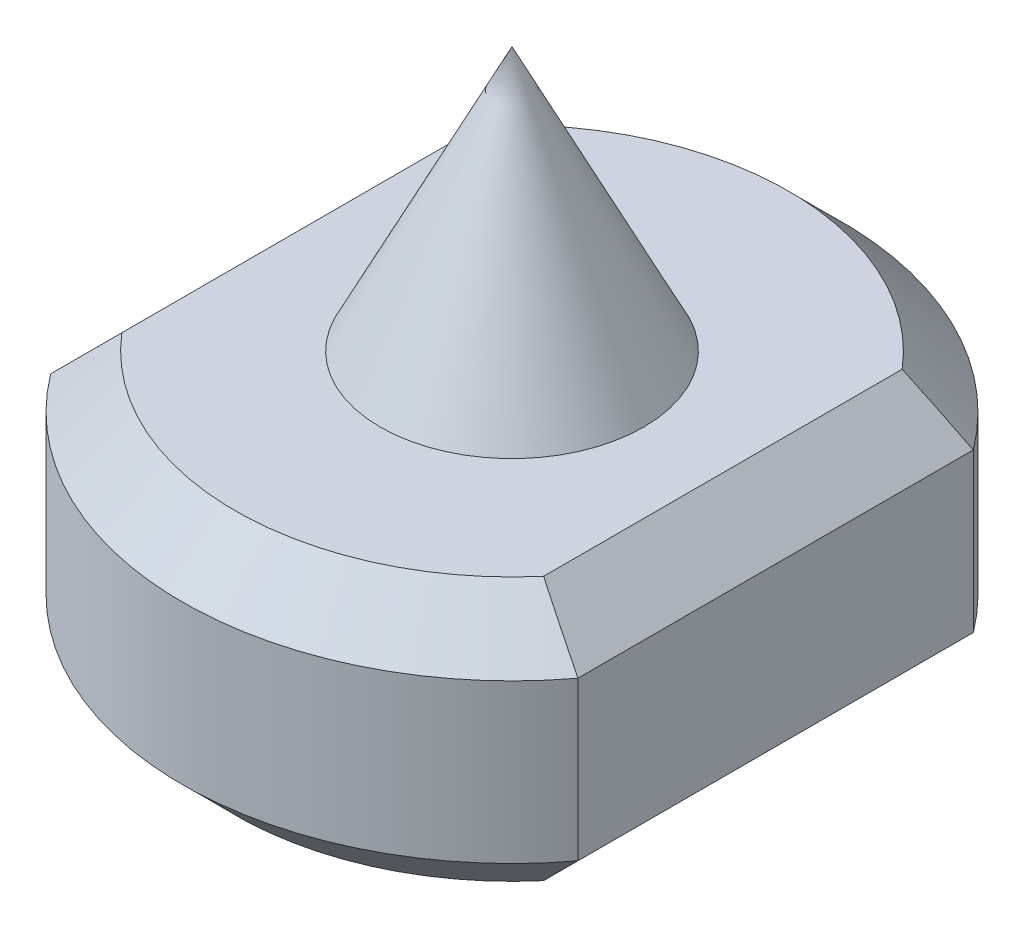
from build123d import *

# Parameters (mm, degrees)
SKETCH1_R           = 12.5
BOSS_EXTRUDE2_DEPTH = 10
CUT_EXTRUDE1_REACH  = 28.693
CHAMFER1_SIZE       = 2


with BuildPart() as part:
    # Sketch1 → Boss-Extrude2 (new body)
    with BuildSketch(Plane(origin=(0, 0, 0), x_dir=(1, 0, 0), z_dir=(0, 1, 0))):
        Circle(SKETCH1_R)
    extrude(amount=BOSS_EXTRUDE2_DEPTH)

    # Sketch2 → Revolve1 (revolve)
    with BuildSketch(Plane.XY):
        Polygon((5, 10), (0, 20), (0, 10), align=None)
    revolve(axis=Axis((0, -1000, 0), (0, 1, 0)))

    # Sketch3 → Cut-Extrude1 (cut, up to next)
    with BuildSketch(Plane(origin=(0, 0, 0), x_dir=(1, 0, 0), z_dir=(0, 1, 0)), mode=Mode.PRIVATE) as cut_extrude1_sk1:
        with BuildLine():
            Line((-10, 7.5), (-10, -7.5))
            ThreePointArc((-10, -7.5), (-12.5, 0), (-10, 7.5))
        make_face()
    cut_extrude1_tool1 = extrude(cut_extrude1_sk1.sketch, amount=CUT_EXTRUDE1_REACH, mode=Mode.PRIVATE) & part.part
    # Sketch3 → Cut-Extrude1 (cut, up to next)
    with BuildSketch(Plane(origin=(0, 0, 0), x_dir=(1, 0, 0), z_dir=(0, 1, 0)), mode=Mode.PRIVATE) as cut_extrude1_sk2:
        with BuildLine():
            Line((10, 7.5), (10, -7.5))
            ThreePointArc((10, -7.5), (12.5, 0), (10, 7.5))
        make_face()
    cut_extrude1_tool2 = extrude(cut_extrude1_sk2.sketch, amount=CUT_EXTRUDE1_REACH, mode=Mode.PRIVATE) & part.part
    add(cut_extrude1_tool1.solids().sort_by_distance((-11.0091, 0, 0))[0], mode=Mode.SUBTRACT)
    add(cut_extrude1_tool2.solids().sort_by_distance((11.0091, 0, 0))[0], mode=Mode.SUBTRACT)

    # Chamfer1
    chamfer1_edges = [part.edges().sort_by_distance(p)[0] for p in [
        (0, 0, 12.5),
        (10, 0, 0),
        (0, 0, -12.5),
        (-10, 0, 0),
        (-10, 10, 0),
        (0, 10, -12.5),
        (10, 10, 0),
        (0, 10, 12.5),
    ]]
    chamfer(chamfer1_edges, length=CHAMFER1_SIZE)


solid = part.part
